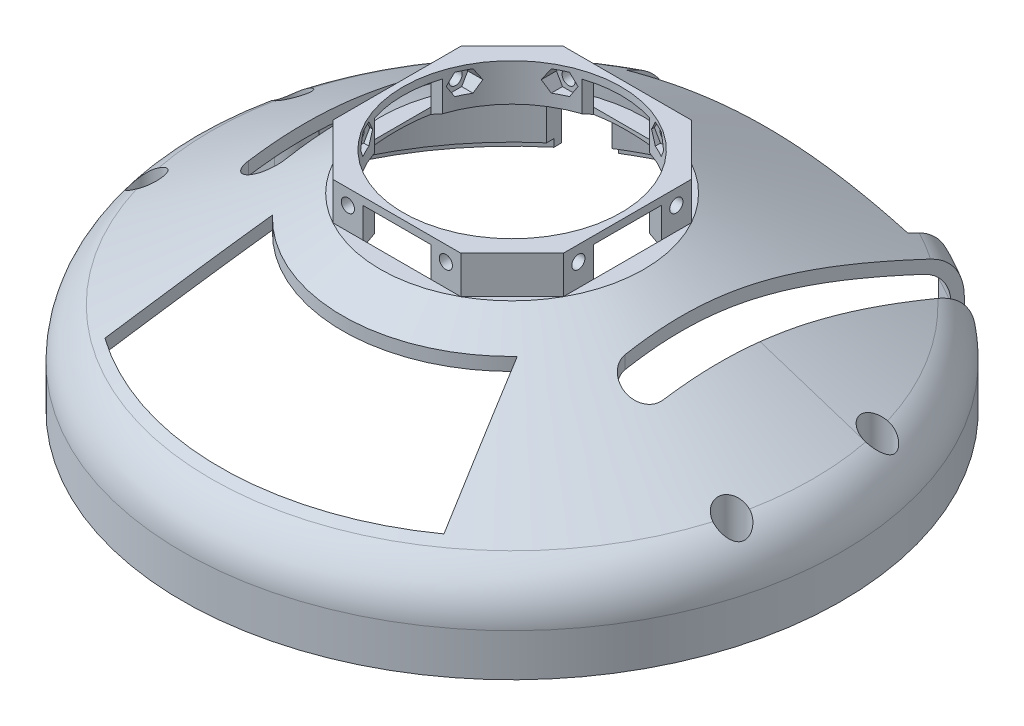
from build123d import *

# Parameters (mm, degrees)
SHELL2_T                                   = -3
SKETCH4_W                                  = 75
SKETCH4_H                                  = 40
CUT_EXTRUDE2_DEPTH                         = 134.463478216
SKETCH5_R                                  = 86
CUT_EXTRUDE3_DEPTH                         = 2
BOSS_EXTRUDE1_REACH                        = 134.727
SKETCH7_R                                  = 1.75
SKETCH8_R                                  = 4
CUT_EXTRUDE4_DEPTH                         = 43
MIRROR1_AT_THE_SECOND_PLANE_COPY_1_REACH   = 134.727
MIRROR1_AT_THE_SECOND_PLANE_COPY_1_SKETC_R = 1.75
MIRROR1_AT_THE_SECOND_PLANE_COPY_2_SKETC_R = 4
MIRROR1_AT_THE_SECOND_PLANE_COPY_2_DEPTH   = 43
CUT_EXTRUDE5_DEPTH                         = 134.463478319
CUT_EXTRUDE6_DEPTH                         = 134.463478319
SKETCH11_R                                 = 28.953306689
BOSS_EXTRUDE2_DEPTH                        = 10
SKETCH13_R                                 = 1.75
SKETCH13_W                                 = 18
SKETCH13_H                                 = 10
CUT_EXTRUDE7_DEPTH                         = 10
CUT_EXTRUDE8_DEPTH                         = 28
CIRPATTERN1_COUNT                          = 4


with BuildPart() as part:
    # Sketch1 → Revolve1 (revolve)
    with BuildSketch(Plane.XY):
        with BuildLine():
            Line((0, 0), (-87.5, 0))
            Line((-87.5, 0), (-87.5, 11.295161968))
            ThreePointArc((-87.5, 11.295161968), (-85.473651397, 18.824064241), (-79.942084075, 24.3188091))
            Line((-79.942084075, 24.3188091), (-35, 50))
            Line((-35, 50), (0, 50))
            Line((0, 50), (0, 0))
        make_face()
    revolve(axis=Axis((0, 50, 0), (0, -1, 0)))

    # Shell2
    shell2_openings = [part.faces().sort_by_distance(p)[0] for p in [
        (0, 0, 0),
        (0, 50, 0),
    ]]
    offset(amount=SHELL2_T, openings=shell2_openings, kind=Kind.INTERSECTION)

    # Sketch4 → Cut-Extrude2 (cut, through all)
    with BuildSketch(Plane(origin=(0, 0, 0), x_dir=(1, 0, 0), z_dir=(0, 1, 0))):
        with Locations((0, 87.5)):
            Rectangle(SKETCH4_W, SKETCH4_H)
    extrude(amount=CUT_EXTRUDE2_DEPTH, mode=Mode.SUBTRACT)

    # Sketch5 → Cut-Extrude3 (cut)
    with BuildSketch(Plane.XZ):
        Circle(SKETCH5_R)
    extrude(amount=-CUT_EXTRUDE3_DEPTH, mode=Mode.SUBTRACT)

    # Sketch7 → Boss-Extrude1 (add, up to next)
    with BuildSketch(Plane.XZ.offset(-2), mode=Mode.PRIVATE) as boss_extrude1_sk1:
        with BuildLine():
            Line((-75.067563926, 23.651004557), (-80.174562715, 26.688752191))
            ThreePointArc((-80.174562715, 26.688752191), (-81.98998887, 20.442400178), (-83.319547357, 14.07490775))
            Line((-83.319547357, 14.07490775), (-77.384198941, 14.359489009))
            ThreePointArc((-77.384198941, 14.359489009), (-72.772179471, 18.14414217), (-75.067563926, 23.651004557))
        make_face()
        with Locations((-77.623658102, 19.353751648)):
            Circle(SKETCH7_R, mode=Mode.SUBTRACT)
    boss_extrude1_tool1 = extrude(boss_extrude1_sk1.sketch, amount=-BOSS_EXTRUDE1_REACH, mode=Mode.PRIVATE) - part.part
    boss_extrude1 = boss_extrude1_tool1.solids().sort_by_distance((-81.82952, 2, 20.402391))[0]
    add(boss_extrude1)

    # Sketch8 → Cut-Extrude4 (cut)
    with BuildSketch(Plane(origin=(0, 50, 0), x_dir=(1, 0, 0), z_dir=(0, 1, 0))):
        with Locations((-77.623658102, -19.353751648)):
            Circle(SKETCH8_R)
    cut_extrude4 = extrude(amount=-CUT_EXTRUDE4_DEPTH, mode=Mode.SUBTRACT)

    # Mirror1: Boss-Extrude1, Cut-Extrude4 across plane
    add(boss_extrude1.mirror(Plane(origin=(0, 0, 0), x_dir=(0, 0, 1), z_dir=(1, 0, 0))))
    add(cut_extrude4.mirror(Plane(origin=(0, 0, 0), x_dir=(0, 0, 1), z_dir=(1, 0, 0))), mode=Mode.SUBTRACT)

    # Mirror1 at the second plane: Boss-Extrude1, Cut-Extrude4 across plane
    add(boss_extrude1.mirror(Plane.XY))
    add(cut_extrude4.mirror(Plane.XY), mode=Mode.SUBTRACT)

    # Mirror1 at the second plane copy 1 sketc → Mirror1 at the second plane copy 1 (add, up to next)
    with BuildSketch(Plane(origin=(0, 2, 0), x_dir=(-1, 0, 0), z_dir=(0, -1, 0)), mode=Mode.PRIVATE) as mirror1_at_the_second_plane_copy_1_sk1:
        with BuildLine():
            Line((-75.067563926, 23.651004557), (-80.174562715, 26.688752191))
            ThreePointArc((-80.174562715, 26.688752191), (-81.98998887, 20.442400178), (-83.319547357, 14.07490775))
            Line((-83.319547357, 14.07490775), (-77.384198941, 14.359489009))
            ThreePointArc((-77.384198941, 14.359489009), (-72.772179471, 18.14414217), (-75.067563926, 23.651004557))
        make_face()
        with Locations((-77.623658102, 19.353751648)):
            Circle(MIRROR1_AT_THE_SECOND_PLANE_COPY_1_SKETC_R, mode=Mode.SUBTRACT)
    mirror1_at_the_second_plane_copy_1_tool1 = extrude(mirror1_at_the_second_plane_copy_1_sk1.sketch, amount=-MIRROR1_AT_THE_SECOND_PLANE_COPY_1_REACH, mode=Mode.PRIVATE) - part.part
    add(mirror1_at_the_second_plane_copy_1_tool1.solids().sort_by_distance((81.82952, 2, -20.402391))[0])

    # Mirror1 at the second plane copy 2 sketc → Mirror1 at the second plane copy 2 (cut)
    with BuildSketch(Plane(origin=(0, 50, 0), x_dir=(-1, 0, 0), z_dir=(0, 1, 0))):
        with Locations((-77.623658102, -19.353751648)):
            Circle(MIRROR1_AT_THE_SECOND_PLANE_COPY_2_SKETC_R)
    extrude(amount=-MIRROR1_AT_THE_SECOND_PLANE_COPY_2_DEPTH, mode=Mode.SUBTRACT)

    # Sketch9 → Cut-Extrude5 (cut, through all)
    with BuildSketch(Plane(origin=(0, 0, 0), x_dir=(1, 0, 0), z_dir=(0, 1, 0))):
        with BuildLine():
            Line((-45, 82.5), (-45, -15))
            ThreePointArc((-45, -15), (-50, -20), (-55, -15))
            Line((-55, -15), (-55, 82.5))
            ThreePointArc((-55, 82.5), (-50, 87.5), (-45, 82.5))
        make_face()
        with BuildLine():
            Line((45, -15), (45, 82.5))
            ThreePointArc((45, 82.5), (50, 87.5), (55, 82.5))
            Line((55, 82.5), (55, -15))
            ThreePointArc((55, -15), (50, -20), (45, -15))
        make_face()
    extrude(amount=CUT_EXTRUDE5_DEPTH, mode=Mode.SUBTRACT)

    # Sketch10 → Cut-Extrude6 (cut, through all)
    with BuildSketch(Plane(origin=(0, 0, 0), x_dir=(1, 0, 0), z_dir=(0, 1, 0))):
        with BuildLine():
            Line((-32.5, -31.124748995), (-45, -63.097147321))
            ThreePointArc((-45, -63.097147321), (0, -77.5), (45, -63.097147321))
            Line((45, -63.097147321), (32.5, -31.124748995))
            ThreePointArc((32.5, -31.124748995), (0, -45), (-32.5, -31.124748995))
        make_face()
    extrude(amount=CUT_EXTRUDE6_DEPTH, mode=Mode.SUBTRACT)

    # Sketch11 → Boss-Extrude2 (add)
    with BuildSketch(Plane(origin=(0, 50, 0), x_dir=(1, 0, 0), z_dir=(0, 1, 0))):
        Polygon((-17, 30.594117082), (-30.594117082, 17), (-30.594117082, -17), (-17, -30.594117082), (17, -30.594117082), (30.594117082, -17), (30.594117082, 17), (17, 30.594117082), align=None)
        Circle(SKETCH11_R, mode=Mode.SUBTRACT)
    extrude(amount=BOSS_EXTRUDE2_DEPTH)

    # Sketch13 → Cut-Extrude7 (cut)
    with BuildSketch(Plane.XY.offset(30.594117082)):
        with Locations((-13, 56)):
            Circle(SKETCH13_R)
        with Locations((13, 56)):
            Circle(SKETCH13_R)
        with Locations((0, 53)):
            Rectangle(SKETCH13_W, SKETCH13_H)
    cut_extrude7 = extrude(amount=-CUT_EXTRUDE7_DEPTH, mode=Mode.SUBTRACT)

    # Sketch14 → Cut-Extrude8 (cut)
    with BuildSketch(Plane.XY):
        Polygon((-9.766838493, 56), (-11.383419246, 58.8), (-14.616580754, 58.8), (-16.233161507, 56), (-14.616580754, 53.2), (-11.383419246, 53.2), align=None)
        Polygon((16.233161507, 56), (14.616580754, 58.8), (11.383419246, 58.8), (9.766838493, 56), (11.383419246, 53.2), (14.616580754, 53.2), align=None)
    cut_extrude8 = extrude(amount=CUT_EXTRUDE8_DEPTH, mode=Mode.SUBTRACT)

    # CirPattern1: Cut-Extrude7, Cut-Extrude8 ×4 about axis
    cirpattern1_axis = Axis((0, 60, 0), (0, 1, 0))
    add([cut_extrude7.rotate(cirpattern1_axis, i * 360 / CIRPATTERN1_COUNT) for i in range(1, CIRPATTERN1_COUNT)], mode=Mode.SUBTRACT)
    add([cut_extrude8.rotate(cirpattern1_axis, i * 360 / CIRPATTERN1_COUNT) for i in range(1, CIRPATTERN1_COUNT)], mode=Mode.SUBTRACT)


solid = part.part
